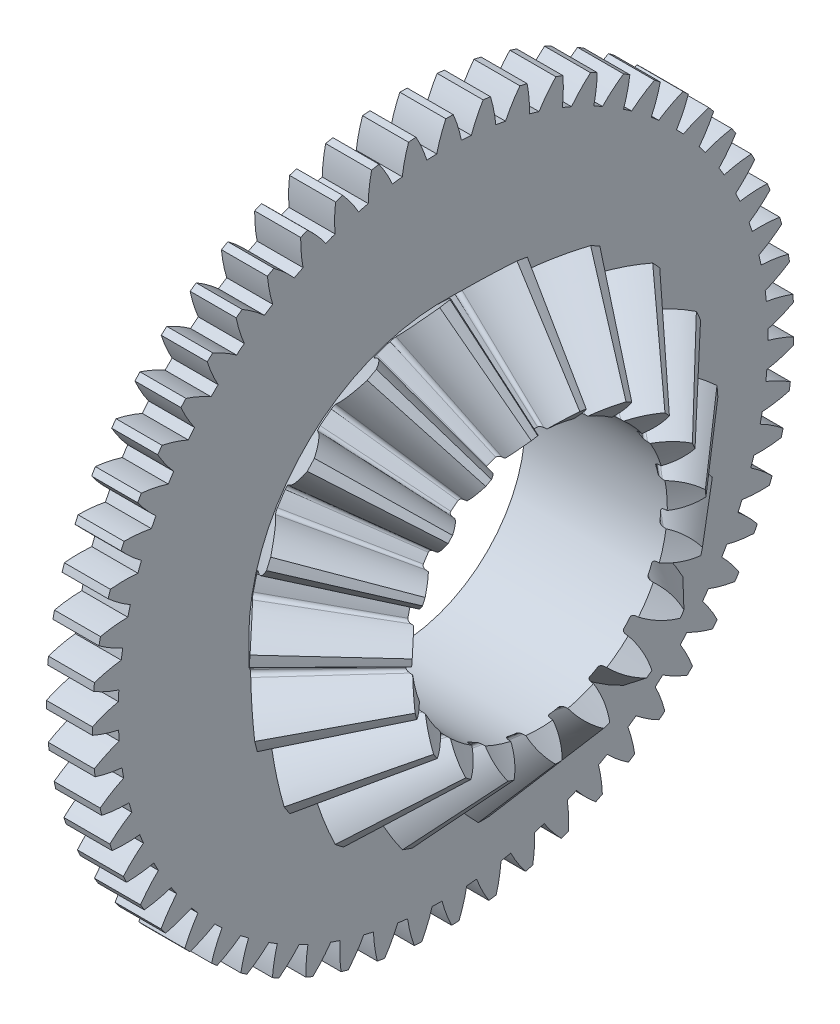
from build123d import *

# Parameters (mm, degrees)
TEETHCUTS_COUNT     = 19
TEETHCUTS_ANGLE     = 341.052631579
HUBSKE_R            = 11.5
HUB_DEPTH           = 0.0005588
BORSKE_R            = 11
BORE_DEPTH          = 21.101499024
BOSS_EXTRUDE1_START = 31.15349
SKETCH1_R           = 11.125
BOSS_EXTRUDE1_DEPTH = 4
SKETCH3_R           = 11.125
CUT_EXTRUDE1_DEPTH  = 46.366563802


with BuildPart() as part:
    # BasProSke → Base-Revolve (revolve)
    with BuildSketch(Plane(origin=(0, 0, 0), x_dir=(1, 0, 0), z_dir=(0, 1, 0)), mode=Mode.PRIVATE) as base_revolve_sk:
        Polygon((0, 0), (0, 16.899008978), (3.515204589, 20.414213561), (10.059956604, 12.816829953), (7.852975702, 10.609849055), (7.852975702, 0), align=None)
    revolve(base_revolve_sk.sketch.rotate(Axis((-10, 0, 0), (1, 0, 0)), 180), axis=Axis((-10, 0, 0), (1, 0, 0)))

    # ToothCut: read off the stored shape, not the designer's step
    # ToothCut: loft between two sections, ruled curve by curve
    toothcut_from = [
        Edge.make_bspline([(21.106983915, 0.00599289, -0.009458337), (21.102776765, 0.001785739, -0.014789731), (21.097156118, -0.003834907, -0.013989325), (21.093785022, -0.007206003, -0.007578755)], [0, 0, 0, 0, 1, 1, 1, 1], 3, [1, 0.782762421, 0.782762421, 1]),
        Edge.make_bspline([(21.093785022, -0.007206003, 0.007578755), (21.097156118, -0.003834907, 0.013989325), (21.102776765, 0.001785739, 0.014789731), (21.106983915, 0.00599289, 0.009458337)], [0, 0, 0, 0, 1, 1, 1, 1], 3, [1, 0.782762421, 0.782762421, 1]),
        Edge.make_bspline([(21.093785022, -0.007206003, -0.007578755), (21.093275499, -0.007715527, -0.006609831), (21.092868168, -0.008122857, -0.005548601), (21.092571247, -0.008419779, -0.004416471)], [0, 0, 0, 0, 1, 1, 1, 1], 3, [1, 0.993277042, 0.993277042, 1]),
        Edge.make_bspline([(21.092571247, -0.008419779, 0.004416471), (21.092868168, -0.008122857, 0.005548601), (21.093275499, -0.007715527, 0.006609831), (21.093785022, -0.007206003, 0.007578755)], [0, 0, 0, 0, 1, 1, 1, 1], 3, [1, 0.993277042, 0.993277042, 1]),
        Edge.make_bspline([(21.092571247, -0.008419779, -0.004416471), (21.091815809, -0.009175216, -0.001536072), (21.091815809, -0.009175216, 0.001536072), (21.092571247, -0.008419779, 0.004416471)], [0, 0, 0, 0, 1, 1, 1, 1], 3, [1, 0.958390627, 0.958390627, 1]),
        Edge.make_line((21.106983915, 0.00599289, 0.009458337), (21.106983915, 0.00599289, -0.009458337)),
    ]
    toothcut_to = [
        Edge.make_bspline([(3.638619532, 20.537628503, -3.233490981), (2.826895847, 19.72590482, -2.04083435), (1.790509199, 18.689518174, -1.271402121), (0.635384071, 17.534393049, -1.00383455)], [0, 0, 0, 0, 1, 1, 1, 1], 3, [1, 0.965931478, 0.965931478, 1]),
        Edge.make_bspline([(0.635384071, 17.534393049, 1.00383455), (1.790509199, 18.689518174, 1.271402121), (2.826895847, 19.72590482, 2.04083435), (3.638619532, 20.537628503, 3.233490981)], [0, 0, 0, 0, 1, 1, 1, 1], 3, [1, 0.965931478, 0.965931478, 1]),
        Edge.make_bspline([(0.635384071, 17.534393049, -1.00383455), (0.496160966, 17.395169944, -0.971585586), (0.406834975, 17.305843953, -0.81715801), (0.41207804, 17.311087018, -0.617781075)], [0, 0, 0, 0, 1, 1, 1, 1], 3, [1, 0.833299949, 0.833299949, 1]),
        Edge.make_bspline([(0.41207804, 17.311087018, 0.617781075), (0.406834975, 17.305843953, 0.81715801), (0.496160966, 17.395169944, 0.971585586), (0.635384071, 17.534393049, 1.00383455)], [0, 0, 0, 0, 1, 1, 1, 1], 3, [1, 0.833299949, 0.833299949, 1]),
        Edge.make_bspline([(0.41207804, 17.311087018, -0.617781075), (0.422906174, 17.321915151, -0.206021909), (0.422906174, 17.321915151, 0.206021909), (0.41207804, 17.311087018, 0.617781075)], [0, 0, 0, 0, 1, 1, 1, 1], 3, [1, 0.999539447, 0.999539447, 1]),
        Edge.make_line((3.638619532, 20.537628503, 3.233490981), (3.638619532, 20.537628503, -3.233490981)),
    ]
    toothcut = Solid(Shell([*[Face.make_surface_from_curves(toothcut_from[k], toothcut_to[k]) for k in range(6)], Face(Wire(toothcut_from)), Face(Wire(toothcut_to))]))
    add(toothcut, mode=Mode.SUBTRACT)

    # TeethCuts: ToothCut ×19 about axis
    teethcuts_axis = Axis((-10, 0, 0), (1, 0, 0))
    for i in range(1, TEETHCUTS_COUNT):
        add(toothcut.rotate(teethcuts_axis, i * TEETHCUTS_ANGLE / (TEETHCUTS_COUNT - 1)), mode=Mode.SUBTRACT)

    # HubSke → Hub (add)
    with BuildSketch(Plane.ZY):
        with Locations(Location((0, 0, 0), (0, 0, 180))):
            Circle(HUBSKE_R)
    extrude(amount=HUB_DEPTH)

    # BorSke → Bore (cut, symmetric)
    with BuildSketch(Plane(origin=(0, 0, 0), x_dir=(0, 0, -1), z_dir=(1, 0, 0))):
        with Locations(Location((0, 0, 0), (0, 0, 180))):
            Circle(BORSKE_R)
    extrude(amount=BORE_DEPTH, both=True, mode=Mode.SUBTRACT)

    # Sketch1 → Boss-Extrude1 (add)
    with BuildSketch(Plane(origin=(-31.153489667, 0, 0), x_dir=(0, 0, -1), z_dir=(1, 0, 0)).offset(BOSS_EXTRUDE1_START)):
        with BuildLine():
            ThreePointArc((23.110293109, 19.903877824), (21.978107084, 19.515777536), (20.89105869, 19.014985349))
            ThreePointArc((20.89105869, 19.014985349), (20.598652936, 19.331360485), (20.3014565, 19.643239676))
            ThreePointArc((20.3014565, 19.643239676), (20.870172522, 20.696344188), (21.329285701, 21.801641486))
            ThreePointArc((21.329285701, 21.801641486), (21.097679229, 22.025846889), (20.863716129, 22.247591988))
            ThreePointArc((20.863716129, 22.247591988), (19.779196697, 21.741346368), (18.751537596, 21.127845105))
            ThreePointArc((18.751537596, 21.127845105), (18.427159764, 21.411347086), (18.098496278, 21.689869374))
            ThreePointArc((18.098496278, 21.689869374), (18.552052261, 22.797458647), (18.89107857, 23.945294954))
            ThreePointArc((18.89107857, 23.945294954), (18.636952621, 24.14361193), (18.380744909, 24.339232046))
            ThreePointArc((18.380744909, 24.339232046), (17.356180108, 23.720577057), (16.399554089, 23.001317934))
            ThreePointArc((16.399554089, 23.001317934), (16.046879508, 23.248734569), (15.690472862, 23.490744185))
            ThreePointArc((15.690472862, 23.490744185), (16.023729835, 24.64026879), (16.23882797, 25.817638663))
            ThreePointArc((16.23882797, 25.817638663), (15.965061892, 25.987820201), (15.689512505, 26.155098879))
            ThreePointArc((15.689512505, 26.155098879), (14.736511063, 25.43104413), (13.861757081, 24.614176639))
            ThreePointArc((13.861757081, 24.614176639), (13.484781695, 24.822704599), (13.104670119, 25.025459478))
            ThreePointArc((13.104670119, 25.025459478), (13.313852147, 26.203894841), (13.402584961, 27.39745821))
            ThreePointArc((13.402584961, 27.39745821), (13.112280634, 27.537576084), (12.820511655, 27.67461799))
            ThreePointArc((12.820511655, 27.67461799), (11.94987146, 26.853367311), (11.166900826, 25.948146888))
            ThreePointArc((11.166900826, 25.948146888), (10.769895918, 26.115423468), (10.370386226, 26.276626315))
            ThreePointArc((10.370386226, 26.276626315), (10.453123195, 27.470620294), (10.414485308, 28.666853608))
            ThreePointArc((10.414485308, 28.666853608), (10.110931996, 28.775320227), (9.806249285, 28.880572622))
            ThreePointArc((9.806249285, 28.880572622), (9.027835037, 27.971431111), (8.345519123, 26.988114265))
            ThreePointArc((8.345519123, 26.988114265), (7.932982916, 27.112244154), (7.518601714, 27.230068477))
            ThreePointArc((7.518601714, 27.230068477), (7.473956179, 28.426092642), (7.308385376, 29.611442099))
            ThreePointArc((7.308385376, 29.611442099), (6.995022458, 29.687028494), (6.680878192, 29.759298825))
            ThreePointArc((6.680878192, 29.759298825), (6.003509637, 28.772567419), (5.429579354, 27.722295523))
            ThreePointArc((5.429579354, 27.722295523), (5.006186048, 27.80187228), (4.581628441, 27.874983082))
            ThreePointArc((4.581628441, 27.874983082), (4.410106254, 29.059486002), (4.119478517, 30.22052112))
            ThreePointArc((4.119478517, 30.22052112), (3.799856522, 30.262370866), (3.47981008, 30.300840282))
            ThreePointArc((3.47981008, 30.300840282), (2.911162073, 29.247699042), (2.452120281, 28.142372095))
            ThreePointArc((2.452120281, 28.142372095), (2.022667092, 28.176494083), (1.592743486, 28.204062991))
            ThreePointArc((1.592743486, 28.204062991), (1.296288063, 29.363623774), (0.88389632, 30.48718956))
            ThreePointArc((0.88389632, 30.48718956), (0.561636692, 30.494828483), (0.239314329, 30.499061111))
            ThreePointArc((0.239314329, 30.499061111), (-0.21417012, 29.391442547), (-0.553122295, 28.243584346))
            ThreePointArc((-0.553122295, 28.243584346), (-0.983769491, 28.231864951), (-1.414187889, 28.213579596))
            ThreePointArc((-1.414187889, 28.213579596), (-1.83221759, 29.335059955), (-2.361700775, 30.408425961))
            ThreePointArc((-2.361700775, 30.408425961), (-2.682946706, 30.381767509), (-3.003892949, 30.351715391))
            ThreePointArc((-3.003892949, 30.351715391), (-3.33707568, 29.202169265), (-3.552097774, 28.024785502))
            ThreePointArc((-3.552097774, 28.024785502), (-3.979059572, 27.967357507), (-4.40509595, 27.903425071))
            ThreePointArc((-4.40509595, 27.903425071), (-4.939963486, 28.974118185), (-5.580538857, 29.985122746))
            ThreePointArc((-5.580538857, 29.985122746), (-5.897131245, 29.924468969), (-6.21306492, 29.860472607))
            ThreePointArc((-6.21306492, 29.860472607), (-6.422170839, 28.682023736), (-6.510826566, 27.488454639))
            ThreePointArc((-6.510826566, 27.488454639), (-6.929265318, 27.385968728), (-7.346092513, 27.27711359))
            ThreePointArc((-7.346092513, 27.27711359), (-7.991737621, 28.284888079), (-8.736147204, 29.222076108))
            ThreePointArc((-8.736147204, 29.222076108), (-9.044498932, 29.128114238), (-9.351840382, 29.030898737))
            ThreePointArc((-9.351840382, 29.030898737), (-9.434500236, 27.836899417), (-9.395785091, 26.640668601))
            ThreePointArc((-9.395785091, 26.640668601), (-9.80095972, 26.49428598), (-10.203854913, 26.341741512))
            ThreePointArc((-10.203854913, 26.341741512), (-10.952962176, 27.275178889), (-11.792771512, 28.127931671))
            ThreePointArc((-11.792771512, 28.127931671), (-12.089388831, 28.001726334), (-12.384655756, 27.872393184))
            ThreePointArc((-12.384655756, 27.872393184), (-12.339932976, 26.676371905), (-12.174285617, 25.491033143))
            ThreePointArc((-12.174285617, 25.491033143), (-12.561605331, 25.302412385), (-12.94600356, 25.107906978))
            ThreePointArc((-12.94600356, 25.107906978), (-13.790085293, 25.956431024), (-14.715779006, 26.715086529))
            ThreePointArc((-14.715779006, 26.715086529), (-14.997301124, 26.558067682), (-15.277148032, 26.398082279))
            ThreePointArc((-15.277148032, 26.398082279), (-15.105549345, 25.21359044), (-14.814846622, 24.052574094))
            ThreePointArc((-14.814846622, 24.052574094), (-15.179922935, 23.823852348), (-15.541468813, 23.589589825))
            ThreePointArc((-15.541468813, 23.589589825), (-16.470961233, 24.343586423), (-17.472050845, 24.999548782))
            ThreePointArc((-17.472050845, 24.999548782), (-17.735288003, 24.813495511), (-17.996544116, 24.624670554))
            ThreePointArc((-17.996544116, 24.624670554), (-17.700013803, 23.46512892), (-17.287549495, 22.34158977))
            ThreePointArc((-17.287549495, 22.34158977), (-17.626245946, 22.075358544), (-17.960843015, 21.803993194))
            ThreePointArc((-17.960843015, 21.803993194), (-18.965214601, 22.454919261), (-20.030357366, 23.000756157))
            ThreePointArc((-20.030357366, 23.000756157), (-20.272326982, 22.78777652), (-20.512032164, 22.572251472))
            ThreePointArc((-20.512032164, 22.572251472), (-20.093930033, 21.450798113), (-19.564377525, 20.377466306))
            ThreePointArc((-19.564377525, 20.377466306), (-19.872856548, 20.076742107), (-20.176713689, 19.771348607))
            ThreePointArc((-20.176713689, 19.771348607), (-21.244584509, 20.311828891), (-22.361711934, 20.741355775))
            ThreePointArc((-22.361711934, 20.741355775), (-22.579672396, 20.503862916), (-22.795110692, 20.264079761))
            ThreePointArc((-22.795110692, 20.264079761), (-22.260174006, 19.193421193), (-21.61953334, 18.182458006))
            ThreePointArc((-21.61953334, 18.182458006), (-21.894299744, 17.850648159), (-22.163974134, 17.51468674))
            ThreePointArc((-22.163974134, 17.51468674), (-23.283244786, 17.938597384), (-24.43969937, 18.246947544))
            ThreePointArc((-24.43969937, 18.246947544), (-24.631181099, 17.987632353), (-24.819911507, 17.726307929))
            ThreePointArc((-24.819911507, 17.726307929), (-24.174201313, 16.718575141), (-23.429731204, 15.781435192))
            ThreePointArc((-23.429731204, 15.781435192), (-23.667671776, 15.422299235), (-23.900107896, 15.059576474))
            ThreePointArc((-23.900107896, 15.059576474), (-25.058096596, 15.3621144), (-26.240775248, 15.545794107))
            ThreePointArc((-26.240775248, 15.545794107), (-26.403608678, 15.267594727), (-26.563492807, 14.987689946))
            ThreePointArc((-26.563492807, 14.987689946), (-25.81432526, 14.054300952), (-24.97446085, 13.201602412))
            ThreePointArc((-24.97446085, 13.201602412), (-25.172879629, 12.819209499), (-25.365443885, 12.433835189))
            ThreePointArc((-25.365443885, 12.433835189), (-26.549030159, 12.611572522), (-27.744532656, 12.66850061))
            ThreePointArc((-27.744532656, 12.66850061), (-27.876872821, 12.374569153), (-28.006099119, 12.079255447))
            ThreePointArc((-28.006099119, 12.079255447), (-27.161962586, 11.230785918), (-26.236219876, 10.4721902))
            ThreePointArc((-26.236219876, 10.4721902), (-26.392868698, 10.070872996), (-26.54337926, 9.667213583))
            ThreePointArc((-26.54337926, 9.667213583), (-27.739152602, 9.718136488), (-28.933933423, 9.647667939))
            ThreePointArc((-28.933933423, 9.647667939), (-29.034280856, 9.341334765), (-29.131385137, 9.033958156))
            ThreePointArc((-29.131385137, 9.033958156), (-28.201844023, 8.280021592), (-27.200712048, 7.62412389))
            ThreePointArc((-27.200712048, 7.62412389), (-27.313816018, 7.208429479), (-27.420567542, 6.791058584))
            ThreePointArc((-27.420567542, 6.791058584), (-28.614979362, 6.714590084), (-29.795501163, 6.517523336))
            ThreePointArc((-29.795501163, 6.517523336), (-29.862718887, 6.202259322), (-29.926600922, 5.886302511))
            ThreePointArc((-29.926600922, 5.886302511), (-28.922187298, 5.235441312), (-27.857009283, 4.689673209))
            ThreePointArc((-27.857009283, 4.689673209), (-27.925286888, 4.264311575), (-27.987069836, 3.837958178))
            ThreePointArc((-27.987069836, 3.837958178), (-29.166586971, 3.634964692), (-30.319473969, 3.313532589))
            ThreePointArc((-30.319473969, 3.313532589), (-30.35280038, 2.992909802), (-30.38273636, 2.671952705))
            ThreePointArc((-30.38273636, 2.671952705), (-29.314830635, 2.131541391), (-28.197675472, 1.702086657))
            ThreePointArc((-28.197675472, 1.702086657), (-28.2203531, 1.271877316), (-28.236467447, 0.841372172))
            ThreePointArc((-28.236467447, 0.841372172), (-29.387725496, 0.514153697), (-30.499915021, 0.071998194))
            ThreePointArc((-30.499915021, 0.071998194), (-30.498972517, -0.250350581), (-30.494623255, -0.572671392))
            ThreePointArc((-30.494623255, -0.572671392), (-29.375325227, -0.996509747), (-28.21885073, -1.304785217))
            ThreePointArc((-28.21885073, -1.304785217), (-28.195671435, -1.73496782), (-28.165934598, -2.164746917))
            ThreePointArc((-28.165934598, -2.164746917), (-29.275889348, -2.612482865), (-30.334779847, -3.17035197))
            ThreePointArc((-30.334779847, -3.17035197), (-30.299579108, -3.490774393), (-30.260993884, -3.810806893))
            ThreePointArc((-30.260993884, -3.810806893), (-29.102985646, -4.11327003), (-27.920295134, -4.296873353))
            ThreePointArc((-27.920295134, -4.296873353), (-27.851521546, -4.722155078), (-27.776270456, -5.146338558))
            ThreePointArc((-27.776270456, -5.146338558), (-28.832345676, -5.709518952), (-29.825939497, -6.376780779))
            ThreePointArc((-29.825939497, -6.376780779), (-29.756879361, -6.691646335), (-29.68449536, -7.00576443))
            ThreePointArc((-29.68449536, -7.00576443), (-28.500897609, -7.183425321), (-27.305391438, -7.240276197))
            ThreePointArc((-27.305391438, -7.240276197), (-27.191802789, -7.655838431), (-27.071890071, -8.069620127))
            ThreePointArc((-27.071890071, -8.069620127), (-28.062120007, -8.741863908), (-28.979159335, -9.510958114))
            ThreePointArc((-28.979159335, -9.510958114), (-28.877022281, -9.816699251), (-28.771659642, -10.121343856))
            ThreePointArc((-28.771659642, -10.121343856), (-27.575883014, -10.172189532), (-26.381106746, -10.101643819))
            ThreePointArc((-26.381106746, -10.101643819), (-26.223990041, -10.502778076), (-26.060774354, -10.901469675))
            ThreePointArc((-26.060774354, -10.901469675), (-26.973939305, -11.675160052), (-27.804033718, -12.537372493))
            ThreePointArc((-27.804033718, -12.537372493), (-27.669976999, -12.830525042), (-27.532829524, -13.122244412))
            ThreePointArc((-27.532829524, -13.122244412), (-26.338422645, -13.045698771), (-25.157913574, -12.84855578))
            ThreePointArc((-25.157913574, -12.84855578), (-24.959049008, -13.230717049), (-24.75437965, -13.609801216))
            ThreePointArc((-24.75437965, -13.609801216), (-25.580133092, -14.476171968), (-26.313877289, -15.421733432))
            ThreePointArc((-26.313877289, -15.421733432), (-26.149419822, -15.698975857), (-25.982041446, -15.974464696))
            ThreePointArc((-25.982041446, -15.974464696), (-24.802537423, -15.771395031), (-23.649671187, -15.44988847))
            ThreePointArc((-23.649671187, -15.44988847), (-23.411311976, -15.808746711), (-23.167507933, -16.163928271))
            ThreePointArc((-23.167507933, -16.163928271), (-23.89649375, -17.113163072), (-24.525574115, -18.131359968))
            ThreePointArc((-24.525574115, -18.131359968), (-24.332579269, -18.389551003), (-24.136866456, -18.645687911))
            ThreePointArc((-24.136866456, -18.645687911), (-22.985629542, -18.318395083), (-21.873468577, -17.87616775))
            ThreePointArc((-21.873468577, -17.87616775), (-21.598315424, -18.207656956), (-21.318139094, -18.53491156))
            ThreePointArc((-21.318139094, -18.53491156), (-21.942097585, -19.556255199), (-22.459386388, -20.635550952))
            ThreePointArc((-22.459386388, -20.635550952), (-22.240040871, -20.871765188), (-22.018211125, -21.105648032))
            ThreePointArc((-22.018211125, -21.105648032), (-20.908285294, -20.657840399), (-19.849430827, -20.099902906))
            ThreePointArc((-19.849430827, -20.099902906), (-19.540601329, -20.400267172), (-19.227227221, -20.695886895))
            ThreePointArc((-19.227227221, -20.695886895), (-19.739088687, -21.777767141), (-20.138724838, -22.905932898))
            ThreePointArc((-20.138724838, -22.905932898), (-19.895513922, -23.117493933), (-19.650080664, -23.326472728))
            ThreePointArc((-19.650080664, -23.326472728), (-18.594041819, -22.763224128), (-17.600491095, -22.095898131))
            ThreePointArc((-17.600491095, -22.095898131), (-17.261484412, -22.36173421), (-16.918463181, -22.622369562))
            ThreePointArc((-16.918463181, -22.622369562), (-17.312428027, -23.752528279), (-17.589883488, -24.916781471))
            ThreePointArc((-17.589883488, -24.916781471), (-17.325562852, -25.101292235), (-17.059306937, -25.282999166))
            ThreePointArc((-17.059306937, -25.282999166), (-16.06912042, -24.610691433), (-15.152130766, -23.841538001))
            ThreePointArc((-15.152130766, -23.841538001), (-14.78678798, -24.069833864), (-14.418006193, -24.292531742))
            ThreePointArc((-14.418006193, -24.292531742), (-14.68961064, -25.458163781), (-14.84174173, -26.645312954))
            ThreePointArc((-14.84174173, -26.645312954), (-14.559306231, -26.800682866), (-14.275244446, -26.953059122))
            ThreePointArc((-14.275244446, -26.953059122), (-13.362129465, -26.17930977), (-12.53209074, -25.317043719))
            ThreePointArc((-12.53209074, -25.317043719), (-12.144551332, -25.505212682), (-11.754187433, -25.68744983))
            ThreePointArc((-11.754187433, -25.68744983), (-11.900354094, -26.875348115), (-11.925437108, -28.071942394))
            ThreePointArc((-11.925437108, -28.071942394), (-11.628086852, -28.196411051), (-11.329437731, -28.317730147))
            ThreePointArc((-11.329437731, -28.317730147), (-10.503740245, -27.451306066), (-9.770057119, -26.505697216))
            ThreePointArc((-9.770057119, -26.505697216), (-9.364712064, -26.651607249), (-8.957189033, -26.791318848))
            ThreePointArc((-8.957189033, -26.791318848), (-8.976261782, -27.988024015), (-8.874012518, -29.18050551))
            ThreePointArc((-8.874012518, -29.18050551), (-8.565116604, -29.272662632), (-8.25526396, -29.361549975))
            ThreePointArc((-8.25526396, -29.361549975), (-7.526339451, -28.412268096), (-6.897324847, -27.394030572))
            ThreePointArc((-6.897324847, -27.394030572), (-6.478766867, -27.496028457), (-6.058702102, -27.591631518))
            ThreePointArc((-6.058702102, -27.591631518), (-5.950464836, -28.783584421), (-5.722041821, -29.958441839))
            ThreePointArc((-5.722041821, -29.958441839), (-5.405100162, -30.017243249), (-5.087554749, -30.07269171))
            ThreePointArc((-5.087554749, -30.07269171), (-4.463662223, -29.051307775), (-3.946443128, -27.971978615))
            ThreePointArc((-3.946443128, -27.971978615), (-3.519414652, -28.028908675), (-3.091567656, -28.079319978))
            ThreePointArc((-3.091567656, -28.079319978), (-2.857246747, -29.253015313), (-2.505238103, -30.39693705))
            ThreePointArc((-2.505238103, -30.39693705), (-2.183841775, -30.421716505), (-1.86220151, -30.443097831))
            ThreePointArc((-1.86220151, -30.443097831), (-1.350409919, -29.361184528), (-0.950846632, -28.232992964))
            ThreePointArc((-0.950846632, -28.232992964), (-0.520186063, -28.244210158), (-0.089404512, -28.248858523))
            ThreePointArc((-0.089404512, -28.248858523), (0.26834509, -29.390997853), (0.739950963, -30.491022819))
            ThreePointArc((0.739950963, -30.491022819), (1.062160412, -30.481499557), (1.384251216, -30.468571489))
            ThreePointArc((1.384251216, -30.468571489), (1.77814307, -29.338387329), (2.055523336, -28.174116221))
            ThreePointArc((2.055523336, -28.174116221), (2.484936442, -28.139493455), (2.91377162, -28.098326213))
            ThreePointArc((2.91377162, -28.098326213), (3.39089647, -29.195968643), (3.97675609, -30.239633116))
            ThreePointArc((3.97675609, -30.239633116), (4.296127896, -30.19591504), (4.615019822, -30.148824057))
            ThreePointArc((4.615019822, -30.148824057), (4.886548986, -28.983174479), (5.038603404, -27.796015483))
            ThreePointArc((5.038603404, -27.796015483), (5.461903625, -27.715945046), (5.883933556, -27.629428639))
            ThreePointArc((5.883933556, -27.629428639), (6.475027638, -28.670137442), (7.168502981, -29.645616287))
            ThreePointArc((7.168502981, -29.645616287), (7.481418535, -29.56819874), (7.79349841, -29.487478402))
            ThreePointArc((7.79349841, -29.487478402), (7.93958835, -28.29957068), (7.964594082, -27.102974783))
            ThreePointArc((7.964594082, -27.102974783), (8.376985256, -26.978363905), (8.787428173, -26.847478599))
            ThreePointArc((8.787428173, -26.847478599), (9.485794155, -27.819462128), (10.279027868, -28.715702779))
            ThreePointArc((10.279027868, -28.715702779), (10.581941713, -28.605462933), (10.883673547, -28.492027835))
            ThreePointArc((10.883673547, -28.492027835), (10.902669006, -27.295321438), (10.800342726, -26.10284655))
            ThreePointArc((10.800342726, -26.10284655), (11.197152298, -25.935107122), (11.591357718, -25.761335898))
            ThreePointArc((11.591357718, -25.761335898), (12.389082835, -26.653581192), (13.273087263, -27.460428884))
            ThreePointArc((13.273087263, -27.460428884), (13.562567263, -27.3186158), (13.850532313, -27.173751207))
            ThreePointArc((13.850532313, -27.173751207), (13.742218066, -25.981805297), (13.513719172, -24.806962634))
            ThreePointArc((13.513719172, -24.806962634), (13.89045113, -24.597995211), (14.263952548, -24.383306968))
            ThreePointArc((14.263952548, -24.383306968), (15.151998255, -25.185704531), (16.116757275, -25.894017358))
            ThreePointArc((16.116757275, -25.894017358), (16.389523506, -25.722237835), (16.660459015, -25.547585119))
            ThreePointArc((16.660459015, -25.547585119), (16.426062303, -24.373904921), (16.07397978, -23.23000592))
            ThreePointArc((16.07397978, -23.23000592), (16.4263656, -22.982178186), (16.774931097, -22.729005427))
            ThreePointArc((16.774931097, -22.729005427), (17.743235481, -23.432463774), (18.777817988, -24.034216268))
            ThreePointArc((18.777817988, -24.034216268), (19.030779899, -23.834416637), (19.281616058, -23.631954684))
            ThreePointArc((19.281616058, -23.631954684), (18.923792691, -22.489838462), (18.452115774, -21.389843956))
            ThreePointArc((18.452115774, -21.389843956), (18.776162784, -21.105963899), (19.095842973, -20.817175173))
            ThreePointArc((19.095842973, -20.817175173), (20.133434759, -21.413723839), (21.226118519, -21.902097904))
            ThreePointArc((21.226118519, -21.902097904), (21.456409951, -21.676541975), (21.684304687, -21.44856476))
            ThreePointArc((21.684304687, -21.44856476), (21.207108947, -20.350953147), (20.621181923, -19.307326514))
            ThreePointArc((20.621181923, -19.307326514), (20.913218541, -18.990610607), (21.200391317, -18.669478005))
            ThreePointArc((21.200391317, -18.669478005), (22.295514176, -19.152357857), (23.433918646, -19.52182002))
            ThreePointArc((23.433918646, -19.52182002), (23.638930306, -19.273063431), (23.841301479, -19.022154026))
            ThreePointArc((23.841301479, -19.022154026), (23.250140184, -17.981483401), (22.556601841, -17.006049347))
            ThreePointArc((22.556601841, -17.006049347), (22.813319176, -16.660086109), (23.064730757, -16.310248192))
            ThreePointArc((23.064730757, -16.310248192), (24.204976509, -16.673988007), (25.376203111, -16.920352114))
            ThreePointArc((25.376203111, -16.920352114), (25.553612134, -16.651213377), (25.728166799, -16.380214687))
            ThreePointArc((25.728166799, -16.380214687), (25.029738042, -15.408276263), (24.236446447, -14.512086845))
            ThreePointArc((24.236446447, -14.512086845), (24.454935789, -14.140796179), (24.667737582, -13.76621675))
            ThreePointArc((24.667737582, -13.76621675), (25.840186786, -14.006695211), (27.030965055, -14.127169857))
            ThreePointArc((27.030965055, -14.127169857), (27.178761326, -13.840698422), (27.323521708, -13.55268097))
            ThreePointArc((27.323521708, -13.55268097), (26.525738967, -12.660487198), (25.641682431, -11.853696602))
            ThreePointArc((25.641682431, -11.853696602), (25.819468207, -11.461285377), (25.991249082, -11.066208571))
            ThreePointArc((25.991249082, -11.066208571), (27.182617422, -11.180700961), (28.379455364, -11.173921122))
            ThreePointArc((28.379455364, -11.173921122), (28.495964292, -10.873362823), (28.609290199, -10.571589962))
            ThreePointArc((28.609290199, -10.571589962), (27.721192671, -9.769249755), (26.756387906, -9.060999239))
            ThreePointArc((26.756387906, -9.060999239), (26.891455734, -8.651913632), (27.020269345, -8.240815827))
            ThreePointArc((27.020269345, -8.240815827), (28.21705814, -8.228024901), (29.406395104, -8.094067394))
            ThreePointArc((29.406395104, -8.094067394), (29.490296596, -7.782827679), (29.570904, -7.470718615))
            ThreePointArc((29.570904, -7.470718615), (28.602554185, -6.767322808), (27.567932816, -6.165637134))
            ThreePointArc((27.567932816, -6.165637134), (27.658752322, -5.744512249), (27.74313916, -5.322051347))
            ThreePointArc((27.74313916, -5.322051347), (28.931788315, -5.182122032), (30.100148637, -4.92250465))
            ThreePointArc((30.100148637, -4.92250465), (30.150492056, -4.604109987), (30.197467643, -4.285201042))
            ThreePointArc((30.197467643, -4.285201042), (29.15983733, -3.688719389), (28.067122031, -3.200415896))
            ThreePointArc((28.067122031, -3.200415896), (28.112664195, -2.772023246), (28.151668122, -2.342985899))
            ThreePointArc((28.151668122, -2.342985899), (29.318709768, -2.077503649), (30.452855459, -1.69516796))
            ThreePointArc((30.452855459, -1.69516796), (30.469070394, -1.373225889), (30.481881911, -1.051130428))
            ThreePointArc((30.481881911, -1.051130428), (29.386727867, -0.568321306), (28.248299538, -0.198932668))
            ThreePointArc((28.248299538, -0.198932668), (28.248048349, 0.231873888), (28.241227436, 0.662626516))
            ThreePointArc((28.241227436, 0.662626516), (29.373438524, 1.05065368), (30.46051926, 1.55137566))
            ThreePointArc((30.46051926, 1.55137566), (30.442421989, 1.873217406), (30.420924277, 2.194849913))
            ThreePointArc((30.420924277, 2.194849913), (29.280655036, 2.558516084), (28.109412524, 2.804804547))
            ThreePointArc((28.109412524, 2.804804547), (28.063370827, 3.233143797), (28.010802358, 3.660731107))
            ThreePointArc((28.010802358, 3.660731107), (29.095354484, 4.166906683), (30.123053206, 4.780341573))
            ThreePointArc((30.123053206, 4.780341573), (30.070848779, 5.0984364), (30.015285415, 5.415961728))
            ThreePointArc((30.015285415, 5.415961728), (28.842820682, 5.656364465), (27.652034634, 5.776762205))
            ThreePointArc((27.652034634, 5.776762205), (27.560724101, 6.197780896), (27.463003697, 6.617358153))
            ThreePointArc((27.463003697, 6.617358153), (28.487608452, 7.235946969), (29.444280923, 7.955144307))
            ThreePointArc((29.444280923, 7.955144307), (29.358560836, 8.265888072), (29.269561377, 8.575708532))
            ThreePointArc((29.269561377, 8.575708532), (28.078185645, 8.690123977), (26.881348143, 8.68326684))
            ThreePointArc((26.881348143, 8.68326684), (26.745803358, 9.092194661), (26.604038231, 9.499007886))
            ThreePointArc((26.604038231, 9.499007886), (27.557086434, 10.223001084), (28.431893171, 11.039812077))
            ThreePointArc((28.431893171, 11.039812077), (28.313628668, 11.33968393), (28.192201512, 11.638289132))
            ThreePointArc((28.192201512, 11.638289132), (26.995413546, 11.625420911), (25.806085236, 11.491386591))
            ThreePointArc((25.806085236, 11.491386591), (25.627841976, 11.883590227), (25.443638381, 12.273030064))
            ThreePointArc((25.443638381, 12.273030064), (26.314331614, 13.094224511), (27.09736071, 13.999394364))
            ThreePointArc((27.09736071, 13.999394364), (26.947891774, 14.284996637), (26.795412739, 14.569003265))
            ThreePointArc((26.795412739, 14.569003265), (25.606772624, 14.428997181), (24.438429072, 14.169304341))
            ThreePointArc((24.438429072, 14.169304341), (24.219506903, 14.540339967), (23.994951941, 14.907993908))
            ThreePointArc((23.994951941, 14.907993908), (24.773424903, 15.817085143), (25.455804324, 16.80035792))
            ThreePointArc((25.455804324, 16.80035792), (25.276824498, 17.068454625), (25.095021233, 17.334644771))
            ThreePointArc((25.095021233, 17.334644771), (23.927996736, 17.069087148), (22.793875741, 16.686678211))
            ThreePointArc((22.793875741, 16.686678211), (22.53675514, 17.032341846), (22.274393108, 17.374044224))
            ThreePointArc((22.274393108, 17.374044224), (22.951825389, 18.36073188), (23.525823503, 19.410966707))
            ThreePointArc((23.525823503, 19.410966707), (23.319360701, 19.658520201), (23.110293109, 19.903877824))
        make_face()
        Circle(SKETCH1_R, mode=Mode.SUBTRACT)
    extrude(amount=-BOSS_EXTRUDE1_DEPTH)

    # Sketch3 → Cut-Extrude1 (cut, through all)
    with BuildSketch(Plane.ZY.offset(4)):
        with Locations(Location((0, 0, 0), (0, 0, 180))):
            Circle(SKETCH3_R)
    extrude(amount=-CUT_EXTRUDE1_DEPTH, mode=Mode.SUBTRACT)


solid = part.part
